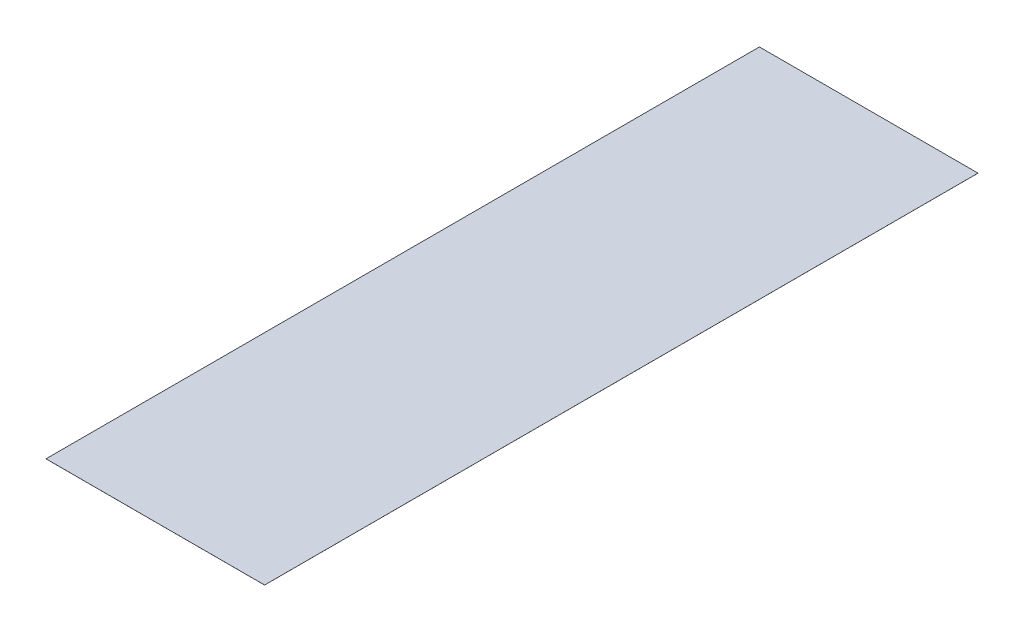
from build123d import *

# Parameters (mm, degrees)
BOSS_EXTRUDE1_OUTLINE_W = 6468.717252399
BOSS_EXTRUDE1_OUTLINE_H = 21110.746168299
BOSS_EXTRUDE1_DEPTH     = 1


with BuildPart() as part:
    # Boss-Extrude1: read off the stored shape, not the designer's step
    # Boss-Extrude1 outline → Boss-Extrude1 (new body)
    with BuildSketch(Plane(origin=(0, 0, 0), x_dir=(1, 0, 0), z_dir=(0, 1, 0))):
        with Locations((-321.791100598, 3594.186087438)):
            Rectangle(BOSS_EXTRUDE1_OUTLINE_W, BOSS_EXTRUDE1_OUTLINE_H)
    extrude(amount=BOSS_EXTRUDE1_DEPTH)


solid = part.part
